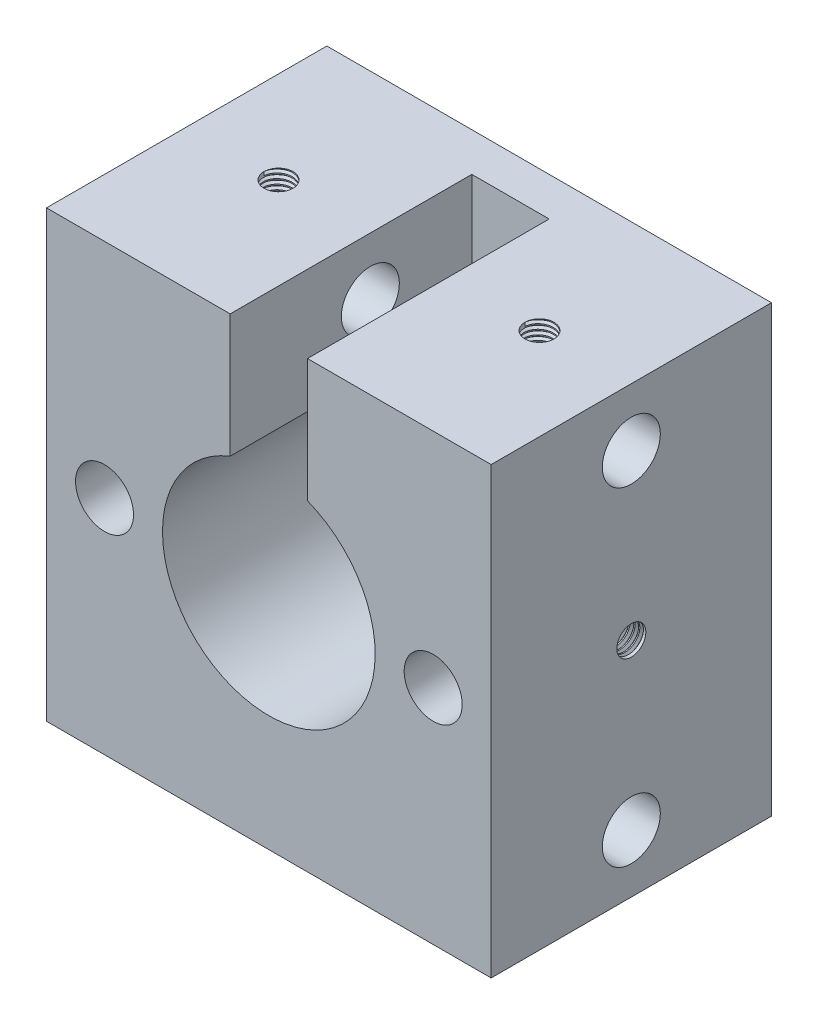
from build123d import *
from build123d.topology import SkipClean

# Parameters (mm, degrees)
SKETCH1_W               = 46
SKETCH1_H               = 46
SKETCH1_R               = 11
BOSS_EXTRUDE1_DEPTH     = 25
SKETCH4_W               = 46
SKETCH4_H               = 46
BOSS_EXTRUDE2_DEPTH     = 4
SKETCH3_R               = 3
CUT_EXTRUDE2_DEPTH      = 58.183914
SKETCH2_R               = 3
CUT_EXTRUDE1_DEPTH      = 44.577517
CUT_EXTRUDE3_REACH      = 45.578
SKETCH5_W               = 8
SKETCH5_H               = 18.96871
SKETCH6_R               = 6.25
CUT_EXTRUDE4_DEPTH      = 42.024383
SKETCH7_R               = 1
CUT_EXTRUDE5_DEPTH      = 44.577517
CUT_EXTRUDE6_REACH      = 59.184
CUT_EXTRUDE6_END_RADIUS = 3
SKETCH9_R               = 1.5
THREAD1_PITCH           = 0.5
THREAD2_PITCH           = 0.5
CUT_EXTRUDE7_REACH      = 59.184
CUT_EXTRUDE7_END_RADIUS = 3
SKETCH15_R              = 1.5
THREAD3_PITCH           = 0.5
THREAD4_PITCH           = 0.5
CUT_EXTRUDE8_REACH      = 59.184
CUT_EXTRUDE8_END_RADIUS = 3
SKETCH20_R              = 1.5
THREAD5_PITCH           = 0.5
CUT_EXTRUDE9_REACH      = 59.184
CUT_EXTRUDE9_END_RADIUS = 3
SKETCH23_R              = 1.5
THREAD6_PITCH           = 0.5


with BuildPart() as part:
    # Sketch1 → Boss-Extrude1 (new body)
    with BuildSketch(Plane.XY):
        Rectangle(SKETCH1_W, SKETCH1_H)
        Circle(SKETCH1_R, mode=Mode.SUBTRACT)
    extrude(amount=BOSS_EXTRUDE1_DEPTH)

    # Sketch4 → Boss-Extrude2 (add)
    with BuildSketch(Plane(origin=(0, 0, 0), x_dir=(-1, 0, 0), z_dir=(0, 0, -1))):
        Rectangle(SKETCH4_W, SKETCH4_H)
    extrude(amount=BOSS_EXTRUDE2_DEPTH)

    # Sketch3 → Cut-Extrude2 (cut, through all)
    with BuildSketch(Plane(origin=(23, 0, 0), x_dir=(0, 0, -1), z_dir=(1, 0, 0))):
        with Locations((-10.5, 17)):
            Circle(SKETCH3_R)
        with Locations((-10.5, -17)):
            Circle(SKETCH3_R)
    extrude(amount=-CUT_EXTRUDE2_DEPTH, mode=Mode.SUBTRACT)

    # Sketch2 → Cut-Extrude1 (cut, through all)
    with BuildSketch(Plane.XY.offset(25)):
        with Locations((17, 0)):
            Circle(SKETCH2_R)
        with Locations((-17, 0)):
            Circle(SKETCH2_R)
    extrude(amount=-CUT_EXTRUDE1_DEPTH, mode=Mode.SUBTRACT)

    # Cut-Extrude3: up to this face of the body (flat: up to its plane)
    cut_extrude3_end = Plane(part.part.faces().sort_by_distance((0, 0, 0))[0])
    # Sketch5 → Cut-Extrude3 (cut, up to the picked face)
    with BuildSketch(Plane.XY.offset(25), mode=Mode.PRIVATE) as cut_extrude3_sk1:
        with Locations((0, 17)):
            Rectangle(SKETCH5_W, SKETCH5_H)
    cut_extrude3_tool1 = split(extrude(cut_extrude3_sk1.sketch, amount=-CUT_EXTRUDE3_REACH, mode=Mode.PRIVATE), bisect_by=cut_extrude3_end, keep=Keep.BOTH, mode=Mode.PRIVATE)
    add(cut_extrude3_tool1.solids().sort_by(Axis((0, 17, 25), (0, 0, -1)))[0], mode=Mode.SUBTRACT)

    # Sketch6 → Cut-Extrude4 (cut, through all)
    with BuildSketch(Plane.XY):
        Circle(SKETCH6_R)
    extrude(amount=-CUT_EXTRUDE4_DEPTH, mode=Mode.SUBTRACT)

    # Sketch7 → Cut-Extrude5 (cut, through all)
    with BuildSketch(Plane(origin=(0, 0, -4), x_dir=(-1, 0, 0), z_dir=(0, 0, -1))):
        with Locations((6.363961, 6.363961)):
            Circle(SKETCH7_R)
        with Locations((6.363961, -6.363961)):
            Circle(SKETCH7_R)
        with Locations((-6.363961, -6.363961)):
            Circle(SKETCH7_R)
        with Locations((-6.363961, 6.363961)):
            Circle(SKETCH7_R)
    extrude(amount=-CUT_EXTRUDE5_DEPTH, mode=Mode.SUBTRACT)

    # Cut-Extrude6: up to this cylinder (the profile starts outside it)
    cut_extrude6_end = Plane(origin=(0, 17, 10.5), z_dir=(1, 0, 0)) * Cylinder(CUT_EXTRUDE6_END_RADIUS, 152.368, mode=Mode.PRIVATE)
    # Sketch9 → Cut-Extrude6 (cut, up to the surface)
    with BuildSketch(Plane(origin=(0, 23, 0), x_dir=(1, 0, 0), z_dir=(0, 1, 0)), mode=Mode.PRIVATE) as cut_extrude6_sk1:
        with Locations(Location((13.5, -10.5, 0), (0, 0, 270))):
            Circle(SKETCH9_R)
    cut_extrude6_tool1 = extrude(cut_extrude6_sk1.sketch, amount=-CUT_EXTRUDE6_REACH, mode=Mode.PRIVATE) - cut_extrude6_end
    add(cut_extrude6_tool1.solids().sort_by_distance((13.5, 23, 10.5))[0], mode=Mode.SUBTRACT)
    # Sketch9 → Cut-Extrude6 (cut, up to the surface)
    with BuildSketch(Plane(origin=(0, 23, 0), x_dir=(1, 0, 0), z_dir=(0, 1, 0)), mode=Mode.PRIVATE) as cut_extrude6_sk2:
        with Locations(Location((-13.5, -10.5, 0), (0, 0, 270))):
            Circle(SKETCH9_R)
    cut_extrude6_tool2 = extrude(cut_extrude6_sk2.sketch, amount=-CUT_EXTRUDE6_REACH, mode=Mode.PRIVATE) - cut_extrude6_end
    add(cut_extrude6_tool2.solids().sort_by_distance((-13.5, 23, 10.5))[0], mode=Mode.SUBTRACT)

    # Thread1: the profile of Thread Profile1 profile screwed along a right-hand helix of 10 turns, 6 arcs to a turn; built about Z, then put on its axis
    with SkipClean():  # the faces are left unmerged after this step: merging them gives an invalid solid
        thread1_z = Axis((0, 0, 0), (0, 0, 1))
        thread1_corners = [(1.4997, 0, -0.000173), (1.770633, 0, 0.15625), (1.770633, 0, 0.21875), (1.4997, 0, 0.375173)]
        with BuildLine(mode=Mode.PRIVATE) as thread1_profile:
            Line(thread1_corners[0], thread1_corners[1])
            Line(thread1_corners[1], thread1_corners[2])
            Line(thread1_corners[2], thread1_corners[3])
            Line(thread1_corners[3], thread1_corners[0])
        thread1_cap = Face(thread1_profile.wire())
        thread1_turn_angles = [0, 30, 60, 90, 120, 150, 180, 210, 240, 270, 300, 330, 360]
        thread1_turn_weights = [1, 0.8660254037844387, 1, 0.8660254037844387, 1, 0.8660254037844387, 1, 0.8660254037844387, 1, 0.8660254037844387, 1, 0.8660254037844387, 1]
        thread1_turn_rails = [Edge.make_bspline([Vector(p[0], p[1], 0).rotate(thread1_z, thread1_turn_angles[k]) / thread1_turn_weights[k] + Vector(0, 0, p[2] + THREAD1_PITCH * thread1_turn_angles[k] / 360) for k in range(13)], [0, 0, 0, 1, 1, 2, 2, 3, 3, 4, 4, 5, 5, 6, 6, 6], 2, thread1_turn_weights) for p in thread1_corners]
        thread1_turn_sides = [Face.make_surface_from_curves(thread1_turn_rails[p[0]], thread1_turn_rails[p[1]]) for p in [(0, 1), (1, 2), (2, 3), (3, 0)]]
        thread1 = Plane(origin=(13.5, 23, 10.5), x_dir=(-1, 0, 0), z_dir=(0, -1, 0)) * Solid(Shell([*[p.moved(Location((0, 0, THREAD1_PITCH * i))) for i in range(10) for p in thread1_turn_sides], thread1_cap, thread1_cap.rotate(thread1_z, 3600).moved(Location((0, 0, THREAD1_PITCH * 3600 / 360)))]))
        add(thread1, mode=Mode.SUBTRACT)

    # Thread2: the profile of Thread Profile2 profile screwed along a right-hand helix of 10 turns, 6 arcs to a turn; built about Z, then put on its axis
    with SkipClean():  # the faces are left unmerged after this step: merging them gives an invalid solid
        thread2_z = Axis((0, 0, 0), (0, 0, 1))
        thread2_corners = [(1.4997, 0, -0.000173), (1.770633, 0, 0.15625), (1.770633, 0, 0.21875), (1.4997, 0, 0.375173)]
        with BuildLine(mode=Mode.PRIVATE) as thread2_profile:
            Line(thread2_corners[0], thread2_corners[1])
            Line(thread2_corners[1], thread2_corners[2])
            Line(thread2_corners[2], thread2_corners[3])
            Line(thread2_corners[3], thread2_corners[0])
        thread2_cap = Face(thread2_profile.wire())
        thread2_turn_angles = [0, 30, 60, 90, 120, 150, 180, 210, 240, 270, 300, 330, 360]
        thread2_turn_weights = [1, 0.8660254037844387, 1, 0.8660254037844387, 1, 0.8660254037844387, 1, 0.8660254037844387, 1, 0.8660254037844387, 1, 0.8660254037844387, 1]
        thread2_turn_rails = [Edge.make_bspline([Vector(p[0], p[1], 0).rotate(thread2_z, thread2_turn_angles[k]) / thread2_turn_weights[k] + Vector(0, 0, p[2] + THREAD2_PITCH * thread2_turn_angles[k] / 360) for k in range(13)], [0, 0, 0, 1, 1, 2, 2, 3, 3, 4, 4, 5, 5, 6, 6, 6], 2, thread2_turn_weights) for p in thread2_corners]
        thread2_turn_sides = [Face.make_surface_from_curves(thread2_turn_rails[p[0]], thread2_turn_rails[p[1]]) for p in [(0, 1), (1, 2), (2, 3), (3, 0)]]
        thread2 = Plane(origin=(-13.5, 23, 10.5), x_dir=(-1, 0, 0), z_dir=(0, -1, 0)) * Solid(Shell([*[p.moved(Location((0, 0, THREAD2_PITCH * i))) for i in range(10) for p in thread2_turn_sides], thread2_cap, thread2_cap.rotate(thread2_z, 3600).moved(Location((0, 0, THREAD2_PITCH * 3600 / 360)))]))
        add(thread2, mode=Mode.SUBTRACT)

    # Cut-Extrude7: up to this cylinder (the profile starts outside it)
    with SkipClean():  # the faces are left unmerged after this step: merging them gives an invalid solid
        cut_extrude7_end = Plane(origin=(0, -17, 10.5), z_dir=(1, 0, 0)) * Cylinder(CUT_EXTRUDE7_END_RADIUS, 152.368, mode=Mode.PRIVATE)
        # Sketch15 → Cut-Extrude7 (cut, up to the surface)
        with BuildSketch(Plane.XZ.offset(23), mode=Mode.PRIVATE) as cut_extrude7_sk1:
            with Locations((13.5, 10.5)):
                Circle(SKETCH15_R)
        cut_extrude7_tool1 = extrude(cut_extrude7_sk1.sketch, amount=-CUT_EXTRUDE7_REACH, mode=Mode.PRIVATE) - cut_extrude7_end
        add(cut_extrude7_tool1.solids().sort_by_distance((13.5, -23, 10.5))[0], mode=Mode.SUBTRACT)
        # Sketch15 → Cut-Extrude7 (cut, up to the surface)
        with BuildSketch(Plane.XZ.offset(23), mode=Mode.PRIVATE) as cut_extrude7_sk2:
            with Locations((-13.5, 10.5)):
                Circle(SKETCH15_R)
        cut_extrude7_tool2 = extrude(cut_extrude7_sk2.sketch, amount=-CUT_EXTRUDE7_REACH, mode=Mode.PRIVATE) - cut_extrude7_end
        add(cut_extrude7_tool2.solids().sort_by_distance((-13.5, -23, 10.5))[0], mode=Mode.SUBTRACT)

    # Thread3: the profile of Thread Profile3 profile screwed along a right-hand helix of 10 turns, 6 arcs to a turn; built about Z, then put on its axis
    thread3_z = Axis((0, 0, 0), (0, 0, 1))
    thread3_corners = [(1.4997, 0, -0.000173), (1.770633, 0, 0.15625), (1.770633, 0, 0.21875), (1.4997, 0, 0.375173)]
    with BuildLine(mode=Mode.PRIVATE) as thread3_profile:
        Line(thread3_corners[0], thread3_corners[1])
        Line(thread3_corners[1], thread3_corners[2])
        Line(thread3_corners[2], thread3_corners[3])
        Line(thread3_corners[3], thread3_corners[0])
    thread3_cap = Face(thread3_profile.wire())
    thread3_turn_angles = [0, 30, 60, 90, 120, 150, 180, 210, 240, 270, 300, 330, 360]
    thread3_turn_weights = [1, 0.8660254037844387, 1, 0.8660254037844387, 1, 0.8660254037844387, 1, 0.8660254037844387, 1, 0.8660254037844387, 1, 0.8660254037844387, 1]
    thread3_turn_rails = [Edge.make_bspline([Vector(p[0], p[1], 0).rotate(thread3_z, thread3_turn_angles[k]) / thread3_turn_weights[k] + Vector(0, 0, p[2] + THREAD3_PITCH * thread3_turn_angles[k] / 360) for k in range(13)], [0, 0, 0, 1, 1, 2, 2, 3, 3, 4, 4, 5, 5, 6, 6, 6], 2, thread3_turn_weights) for p in thread3_corners]
    thread3_turn_sides = [Face.make_surface_from_curves(thread3_turn_rails[p[0]], thread3_turn_rails[p[1]]) for p in [(0, 1), (1, 2), (2, 3), (3, 0)]]
    thread3 = Plane(origin=(13.5, -23, 10.5), x_dir=(1, 0, 0), z_dir=(0, 1, 0)) * Solid(Shell([*[p.moved(Location((0, 0, THREAD3_PITCH * i))) for i in range(10) for p in thread3_turn_sides], thread3_cap, thread3_cap.rotate(thread3_z, 3600).moved(Location((0, 0, THREAD3_PITCH * 3600 / 360)))]))
    add(thread3, mode=Mode.SUBTRACT)

    # Thread4: the profile of Thread Profile4 profile screwed along a right-hand helix of 10 turns, 6 arcs to a turn; built about Z, then put on its axis
    thread4_z = Axis((0, 0, 0), (0, 0, 1))
    thread4_corners = [(1.4997, 0, -0.000173), (1.770633, 0, 0.15625), (1.770633, 0, 0.21875), (1.4997, 0, 0.375173)]
    with BuildLine(mode=Mode.PRIVATE) as thread4_profile:
        Line(thread4_corners[0], thread4_corners[1])
        Line(thread4_corners[1], thread4_corners[2])
        Line(thread4_corners[2], thread4_corners[3])
        Line(thread4_corners[3], thread4_corners[0])
    thread4_cap = Face(thread4_profile.wire())
    thread4_turn_angles = [0, 30, 60, 90, 120, 150, 180, 210, 240, 270, 300, 330, 360]
    thread4_turn_weights = [1, 0.8660254037844387, 1, 0.8660254037844387, 1, 0.8660254037844387, 1, 0.8660254037844387, 1, 0.8660254037844387, 1, 0.8660254037844387, 1]
    thread4_turn_rails = [Edge.make_bspline([Vector(p[0], p[1], 0).rotate(thread4_z, thread4_turn_angles[k]) / thread4_turn_weights[k] + Vector(0, 0, p[2] + THREAD4_PITCH * thread4_turn_angles[k] / 360) for k in range(13)], [0, 0, 0, 1, 1, 2, 2, 3, 3, 4, 4, 5, 5, 6, 6, 6], 2, thread4_turn_weights) for p in thread4_corners]
    thread4_turn_sides = [Face.make_surface_from_curves(thread4_turn_rails[p[0]], thread4_turn_rails[p[1]]) for p in [(0, 1), (1, 2), (2, 3), (3, 0)]]
    thread4 = Plane(origin=(-13.5, -23, 10.5), x_dir=(1, 0, 0), z_dir=(0, 1, 0)) * Solid(Shell([*[p.moved(Location((0, 0, THREAD4_PITCH * i))) for i in range(10) for p in thread4_turn_sides], thread4_cap, thread4_cap.rotate(thread4_z, 3600).moved(Location((0, 0, THREAD4_PITCH * 3600 / 360)))]))
    add(thread4, mode=Mode.SUBTRACT)

    # Cut-Extrude8: up to this cylinder (the profile starts outside it)
    cut_extrude8_end = Plane(origin=(17, 0, 10.5), z_dir=(0, 0, 1)) * Cylinder(CUT_EXTRUDE8_END_RADIUS, 125.368, mode=Mode.PRIVATE)
    # Sketch20 → Cut-Extrude8 (cut, up to the surface)
    with BuildSketch(Plane(origin=(23, 0, 0), x_dir=(0, 0, -1), z_dir=(1, 0, 0)), mode=Mode.PRIVATE) as cut_extrude8_sk1:
        with Locations((-10.5, 0)):
            Circle(SKETCH20_R)
    cut_extrude8_tool1 = extrude(cut_extrude8_sk1.sketch, amount=-CUT_EXTRUDE8_REACH, mode=Mode.PRIVATE) - cut_extrude8_end
    add(cut_extrude8_tool1.solids().sort_by_distance((23, 0, 10.5))[0], mode=Mode.SUBTRACT)

    # Thread5: the profile of Thread Profile5 profile screwed along a right-hand helix of 10 turns, 6 arcs to a turn; built about Z, then put on its axis
    thread5_z = Axis((0, 0, 0), (0, 0, 1))
    thread5_corners = [(1.4997, 0, -0.000173), (1.770633, 0, 0.15625), (1.770633, 0, 0.21875), (1.4997, 0, 0.375173)]
    with BuildLine(mode=Mode.PRIVATE) as thread5_profile:
        Line(thread5_corners[0], thread5_corners[1])
        Line(thread5_corners[1], thread5_corners[2])
        Line(thread5_corners[2], thread5_corners[3])
        Line(thread5_corners[3], thread5_corners[0])
    thread5_cap = Face(thread5_profile.wire())
    thread5_turn_angles = [0, 30, 60, 90, 120, 150, 180, 210, 240, 270, 300, 330, 360]
    thread5_turn_weights = [1, 0.8660254037844387, 1, 0.8660254037844387, 1, 0.8660254037844387, 1, 0.8660254037844387, 1, 0.8660254037844387, 1, 0.8660254037844387, 1]
    thread5_turn_rails = [Edge.make_bspline([Vector(p[0], p[1], 0).rotate(thread5_z, thread5_turn_angles[k]) / thread5_turn_weights[k] + Vector(0, 0, p[2] + THREAD5_PITCH * thread5_turn_angles[k] / 360) for k in range(13)], [0, 0, 0, 1, 1, 2, 2, 3, 3, 4, 4, 5, 5, 6, 6, 6], 2, thread5_turn_weights) for p in thread5_corners]
    thread5_turn_sides = [Face.make_surface_from_curves(thread5_turn_rails[p[0]], thread5_turn_rails[p[1]]) for p in [(0, 1), (1, 2), (2, 3), (3, 0)]]
    thread5 = Plane(origin=(23, 0, 10.5), x_dir=(0, 0, 1), z_dir=(-1, 0, 0)) * Solid(Shell([*[p.moved(Location((0, 0, THREAD5_PITCH * i))) for i in range(10) for p in thread5_turn_sides], thread5_cap, thread5_cap.rotate(thread5_z, 3600).moved(Location((0, 0, THREAD5_PITCH * 3600 / 360)))]))
    add(thread5, mode=Mode.SUBTRACT)

    # Cut-Extrude9: up to this cylinder (the profile starts outside it)
    cut_extrude9_end = Plane(origin=(-17, 0, 10.5), z_dir=(0, 0, 1)) * Cylinder(CUT_EXTRUDE9_END_RADIUS, 125.368, mode=Mode.PRIVATE)
    # Sketch23 → Cut-Extrude9 (cut, up to the surface)
    with BuildSketch(Plane.ZY.offset(23), mode=Mode.PRIVATE) as cut_extrude9_sk1:
        with Locations((10.5, 0)):
            Circle(SKETCH23_R)
    cut_extrude9_tool1 = extrude(cut_extrude9_sk1.sketch, amount=-CUT_EXTRUDE9_REACH, mode=Mode.PRIVATE) - cut_extrude9_end
    add(cut_extrude9_tool1.solids().sort_by_distance((-23, 0, 10.5))[0], mode=Mode.SUBTRACT)

    # Thread6: the profile of Thread Profile6 profile screwed along a right-hand helix of 10 turns, 6 arcs to a turn; built about Z, then put on its axis
    thread6_z = Axis((0, 0, 0), (0, 0, 1))
    thread6_corners = [(1.4997, 0, -0.000173), (1.770633, 0, 0.15625), (1.770633, 0, 0.21875), (1.4997, 0, 0.375173)]
    with BuildLine(mode=Mode.PRIVATE) as thread6_profile:
        Line(thread6_corners[0], thread6_corners[1])
        Line(thread6_corners[1], thread6_corners[2])
        Line(thread6_corners[2], thread6_corners[3])
        Line(thread6_corners[3], thread6_corners[0])
    thread6_cap = Face(thread6_profile.wire())
    thread6_turn_angles = [0, 30, 60, 90, 120, 150, 180, 210, 240, 270, 300, 330, 360]
    thread6_turn_weights = [1, 0.8660254037844387, 1, 0.8660254037844387, 1, 0.8660254037844387, 1, 0.8660254037844387, 1, 0.8660254037844387, 1, 0.8660254037844387, 1]
    thread6_turn_rails = [Edge.make_bspline([Vector(p[0], p[1], 0).rotate(thread6_z, thread6_turn_angles[k]) / thread6_turn_weights[k] + Vector(0, 0, p[2] + THREAD6_PITCH * thread6_turn_angles[k] / 360) for k in range(13)], [0, 0, 0, 1, 1, 2, 2, 3, 3, 4, 4, 5, 5, 6, 6, 6], 2, thread6_turn_weights) for p in thread6_corners]
    thread6_turn_sides = [Face.make_surface_from_curves(thread6_turn_rails[p[0]], thread6_turn_rails[p[1]]) for p in [(0, 1), (1, 2), (2, 3), (3, 0)]]
    thread6 = Plane(origin=(-23, 0, 10.5), x_dir=(0, 0, -1), z_dir=(1, 0, 0)) * Solid(Shell([*[p.moved(Location((0, 0, THREAD6_PITCH * i))) for i in range(10) for p in thread6_turn_sides], thread6_cap, thread6_cap.rotate(thread6_z, 3600).moved(Location((0, 0, THREAD6_PITCH * 3600 / 360)))]))
    add(thread6, mode=Mode.SUBTRACT)


solid = part.part
